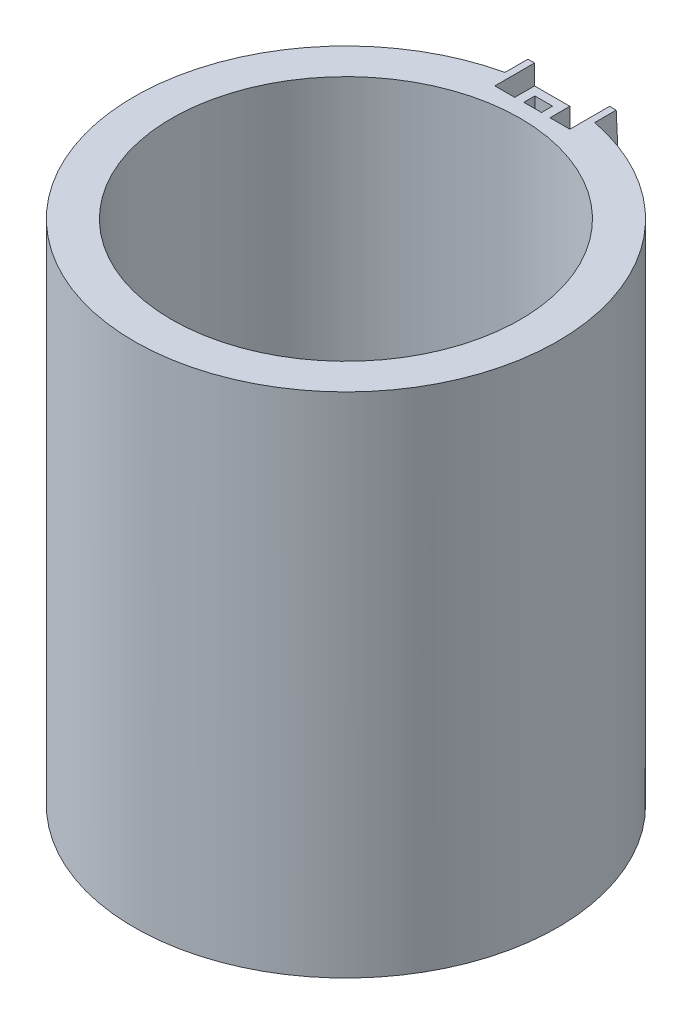
from build123d import *

# Parameters (mm, degrees)
SKETCH1_R           = 48
BOSS_EXTRUDE1_DEPTH = 115
SKETCH2_R           = 39.5
CUT_EXTRUDE3_DEPTH  = 115
SKETCH9_W           = 4.5
SKETCH9_H           = 9
CUT_EXTRUDE5_DEPTH  = 115
SKETCH14_W          = 4
SKETCH14_H          = 2.5
CUT_EXTRUDE8_DEPTH  = 115
SKETCH16_W          = 8
SKETCH16_H          = 4.5
CUT_EXTRUDE9_DEPTH  = 115
SKETCH19_R          = 41
BOSS_EXTRUDE2_DEPTH = 1
SKETCH21_R          = 3
BOSS_EXTRUDE3_DEPTH = 50
SHELL1_T            = -0.3
SKETCH24_R          = 3
BOSS_EXTRUDE4_DEPTH = 35
SHELL2_START        = 19
SHELL2_OUTLINE_R    = 2.7
SHELL2_DEPTH        = 35
SKETCH25_R          = 3
BOSS_EXTRUDE5_DEPTH = 45
SHELL5_T            = -0.03
SKETCH26_W          = 30
SKETCH26_H          = 15
BOSS_EXTRUDE6_DEPTH = 5


# Read off the part's stored shape, not the designer's step: Shell2
with BuildPart() as part:
    # Sketch1 → Boss-Extrude1 (new body)
    with BuildSketch(Plane(origin=(0, 0, 0), x_dir=(1, 0, 0), z_dir=(0, 1, 0))):
        with Locations(Location((0, 0, 0), (0, 0, 270))):
            Circle(SKETCH1_R)
    extrude(amount=BOSS_EXTRUDE1_DEPTH)

    # Sketch7 → Loft2 section 0
    with BuildSketch(Plane.XZ):
        with BuildLine():
            Line((-15.1377027, -38.271634302), (14.891561193, -38.271634302))
            Line((14.891561193, -38.271634302), (14.891561193, -51.96970786))
            Line((14.891561193, -51.96970786), (-15.1377027, -51.96970786))
            Line((-15.1377027, -51.96970786), (-15.1377027, -38.271634302))
        make_face()
    # Sketch6 → Loft2 section 1
    with BuildSketch(Plane(origin=(0, 115, 0), x_dir=(1, 0, 0), z_dir=(0, 1, 0))):
        with BuildLine():
            Line((-10.741203576, 39.96970786), (9.258796424, 39.96970786))
            Line((9.258796424, 39.96970786), (9.258796424, 51.96970786))
            Line((9.258796424, 51.96970786), (-10.741203576, 51.96970786))
            Line((-10.741203576, 51.96970786), (-10.741203576, 39.96970786))
        make_face()
    loft()

    # Sketch2 → Cut-Extrude3 (cut)
    with BuildSketch(Plane(origin=(0, 115, 0), x_dir=(1, 0, 0), z_dir=(0, 1, 0))):
        with Locations(Location((0, 0, 0), (0, 0, 270))):
            Circle(SKETCH2_R)
    extrude(amount=-CUT_EXTRUDE3_DEPTH, mode=Mode.SUBTRACT)

    # Sketch9 → Cut-Extrude5 (cut)
    with BuildSketch(Plane(origin=(0, 115, 0), x_dir=(1, 0, 0), z_dir=(0, 1, 0))):
        with Locations((-6.991203576, 47.46970786)):
            Rectangle(SKETCH9_W, SKETCH9_H)
        with Locations((5.508796424, 47.46970786)):
            Rectangle(SKETCH9_W, SKETCH9_H)
    extrude(amount=-CUT_EXTRUDE5_DEPTH, mode=Mode.SUBTRACT)

    # Sketch14 → Cut-Extrude8 (cut)
    with BuildSketch(Plane(origin=(0, 115, 0), x_dir=(1, 0, 0), z_dir=(0, 1, 0))):
        with Locations((-0.741203576, 44.290749204)):
            Rectangle(SKETCH14_W, SKETCH14_H)
    extrude(amount=-CUT_EXTRUDE8_DEPTH, mode=Mode.SUBTRACT)

    # Sketch16 → Cut-Extrude9 (cut)
    with BuildSketch(Plane(origin=(0, 115, 0), x_dir=(1, 0, 0), z_dir=(0, 1, 0))):
        with Locations((-0.741203576, 49.71970786)):
            Rectangle(SKETCH16_W, SKETCH16_H)
    extrude(amount=-CUT_EXTRUDE9_DEPTH, mode=Mode.SUBTRACT)

    # Sketch19 → Boss-Extrude2 (add)
    with BuildSketch(Plane(origin=(0, 54, 0), x_dir=(1, 0, 0), z_dir=(0, 1, 0))):
        Circle(SKETCH19_R)
    extrude(amount=BOSS_EXTRUDE2_DEPTH)

    # Sketch21 → Boss-Extrude3 (add)
    with BuildSketch(Plane.XZ.offset(-54)):
        with Locations(Location((-35.3, 0, 0), (0, 0, 90))):
            Circle(SKETCH21_R)
        with Locations(Location((35.3, 0, 0), (0, 0, 90))):
            Circle(SKETCH21_R)
    extrude(amount=BOSS_EXTRUDE3_DEPTH)

    # Shell1
    shell1_openings = [part.faces().sort_by_distance(p)[0] for p in [
        (-35.3, 4, 0),
        (35.3, 4, 0),
    ]]
    offset(amount=SHELL1_T, openings=shell1_openings, kind=Kind.INTERSECTION)

    # Sketch24 → Boss-Extrude4 (add)
    with BuildSketch(Plane.XZ.offset(-54)):
        with Locations(Location((7.5, 30, 0), (0, 0, 90))):
            Circle(SKETCH24_R)
        with Locations(Location((-7.5, 30, 0), (0, 0, 90))):
            Circle(SKETCH24_R)
    extrude(amount=BOSS_EXTRUDE4_DEPTH)

    # Shell2 outline → Shell2 (cut)
    with BuildSketch(Plane(origin=(0, 0, 0), x_dir=(1, 0, 0), z_dir=(0, 1, 0)).offset(SHELL2_START)):
        with Locations((-7.5, -30)):
            Circle(SHELL2_OUTLINE_R)
        with Locations((7.5, -30)):
            Circle(SHELL2_OUTLINE_R)
    extrude(amount=SHELL2_DEPTH, mode=Mode.SUBTRACT)

    # Sketch25 → Boss-Extrude5 (add)
    with BuildSketch(Plane.XZ.offset(-54)):
        with Locations(Location((14, -32.5, 0), (0, 0, 90))):
            Circle(SKETCH25_R)
        with Locations(Location((-14, -32.5, 0), (0, 0, 90))):
            Circle(SKETCH25_R)
    extrude(amount=BOSS_EXTRUDE5_DEPTH)

    # Shell5
    shell5_openings = [part.faces().sort_by_distance(p)[0] for p in [
        (-14, 9, -32.5),
        (14, 9, -32.5),
    ]]
    offset(amount=SHELL5_T, openings=shell5_openings, kind=Kind.INTERSECTION)

    # Sketch26 → Boss-Extrude6 (add)
    with BuildSketch(Plane.XZ.offset(-54)):
        Rectangle(SKETCH26_W, SKETCH26_H)
    extrude(amount=BOSS_EXTRUDE6_DEPTH)


solid = part.part
